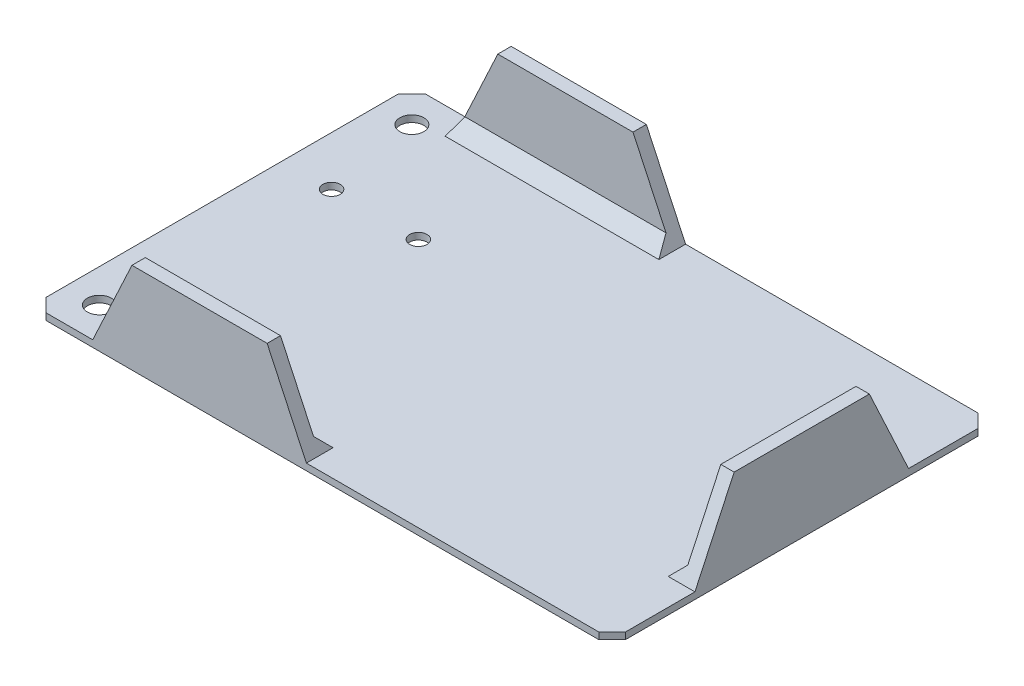
from build123d import *

# Parameters (mm, degrees)
SKETCH1_W           = 110.236
SKETCH1_H           = 72.136
BOSS_EXTRUDE1_DEPTH = 1.27
SKETCH2_R           = 2.286
SKETCH2_R_2         = 1.651
CUT_EXTRUDE1_DEPTH  = 1.27
SKETCH3_W           = 25.4
SKETCH3_H           = 2.54
SKETCH3_W_2         = 2.54
SKETCH3_H_2         = 25.4
BOSS_EXTRUDE2_DEPTH = 16
CHAMFER1_SIZE       = 7.62
CHAMFER1_SIZE_2     = 16.341142734
CHAMFER2_SIZE       = 2.54
CHAMFER3_SIZE       = 2.54


with BuildPart() as part:
    # Sketch1 → Boss-Extrude1 (new body)
    with BuildSketch(Plane(origin=(0, 0, 0), x_dir=(1, 0, 0), z_dir=(0, 1, 0))):
        with Locations((55.118, 36.068)):
            Rectangle(SKETCH1_W, SKETCH1_H)
    extrude(amount=BOSS_EXTRUDE1_DEPTH)

    # Sketch2 → Cut-Extrude1 (cut)
    with BuildSketch(Plane(origin=(0, 1.27, 0), x_dir=(1, 0, 0), z_dir=(0, 1, 0))):
        with Locations(Location((6.35, 65.786, 0), (0, 0, 270))):
            Circle(SKETCH2_R)
        with Locations(Location((9.363, 47.498, 0), (0, 0, 270))):
            Circle(SKETCH2_R_2)
        with Locations(Location((25.873, 47.498, 0), (0, 0, 270))):
            Circle(SKETCH2_R_2)
        with Locations(Location((6.35, 6.35, 0), (0, 0, 90))):
            Circle(SKETCH2_R)
    extrude(amount=-CUT_EXTRUDE1_DEPTH, mode=Mode.SUBTRACT)

    # Sketch3 → Boss-Extrude2 (add)
    with BuildSketch(Plane(origin=(0, 1.27, 0), x_dir=(1, 0, 0), z_dir=(0, 1, 0))):
        with Locations((31.75, 70.866)):
            Rectangle(SKETCH3_W, SKETCH3_H)
        with Locations((31.75, 1.27)):
            Rectangle(SKETCH3_W, SKETCH3_H)
        with Locations((108.966, 36.068)):
            Rectangle(SKETCH3_W_2, SKETCH3_H_2)
    extrude(amount=BOSS_EXTRUDE2_DEPTH)

    # Chamfer1
    # the kernel refuses this chamfer: 16.341142734, 7.62 mm, written as the material it adds along each edge
    with BuildSketch(Plane(origin=(44.45, 1.27, -2.54), x_dir=(0.9971975577536774, -0.07481330637060034, 0), z_dir=(0, 0, 1))) as chamfer1_piece_1_section:
        Polygon((CHAMFER1_SIZE * 0.997197557754, CHAMFER1_SIZE * 0.0748133063706), (-CHAMFER1_SIZE_2 * 0.0748133063719, CHAMFER1_SIZE_2 * 0.997197557771), (0, 0), align=None)
    chamfer1_piece_1 = extrude(amount=2.54, mode=Mode.PRIVATE)
    chamfer1_piece_1 = split(chamfer1_piece_1, bisect_by=Plane(origin=(46.87141812, 17.27, -1.27), z_dir=(0, -1, 0)), keep=Keep.TOP, mode=Mode.PRIVATE)
    add(chamfer1_piece_1)
    with BuildSketch(Plane(origin=(44.45, 1.27, -72.136), x_dir=(0.9971975577536774, -0.07481330637060034, 2.7895727589747506e-15), z_dir=(0, 0, 1))) as chamfer1_piece_2_section:
        Polygon((CHAMFER1_SIZE * 0.997197557754, CHAMFER1_SIZE * 0.0748133063706), (-CHAMFER1_SIZE_2 * 0.0748133063719, CHAMFER1_SIZE_2 * 0.997197557771), (0, 0), align=None)
    chamfer1_piece_2 = extrude(amount=2.54, mode=Mode.PRIVATE)
    chamfer1_piece_2 = split(chamfer1_piece_2, bisect_by=Plane(origin=(46.87141812, 17.27, -70.866), z_dir=(0, -1, 0)), keep=Keep.TOP, mode=Mode.PRIVATE)
    add(chamfer1_piece_2)
    with BuildSketch(Plane(origin=(19.05, 1.27, 0), x_dir=(-0.9971975577536774, -0.07481330637060028, 0), z_dir=(0, 0, -1))) as chamfer1_piece_3_section:
        Polygon((CHAMFER1_SIZE * 0.997197557754, CHAMFER1_SIZE * 0.0748133063706), (-CHAMFER1_SIZE_2 * 0.0748133063719, CHAMFER1_SIZE_2 * 0.997197557771), (0, 0), align=None)
    chamfer1_piece_3 = extrude(amount=2.54, mode=Mode.PRIVATE)
    chamfer1_piece_3 = split(chamfer1_piece_3, bisect_by=Plane(origin=(16.62858188, 17.27, -1.27), z_dir=(0, -1, 0)), keep=Keep.TOP, mode=Mode.PRIVATE)
    add(chamfer1_piece_3)
    with BuildSketch(Plane(origin=(19.05, 1.27, -69.596), x_dir=(-0.9971975577536774, -0.07481330637060032, 5.5791455179495004e-15), z_dir=(0, 0, -1))) as chamfer1_piece_4_section:
        Polygon((CHAMFER1_SIZE * 0.997197557754, CHAMFER1_SIZE * 0.0748133063706), (-CHAMFER1_SIZE_2 * 0.0748133063719, CHAMFER1_SIZE_2 * 0.997197557771), (0, 0), align=None)
    chamfer1_piece_4 = extrude(amount=2.54, mode=Mode.PRIVATE)
    chamfer1_piece_4 = split(chamfer1_piece_4, bisect_by=Plane(origin=(16.62858188, 17.27, -70.866), z_dir=(0, -1, 0)), keep=Keep.TOP, mode=Mode.PRIVATE)
    add(chamfer1_piece_4)
    with BuildSketch(Plane(origin=(107.696, 1.27, -48.768), x_dir=(0, -0.07481330637060034, -0.9971975577536774), z_dir=(1, 0, 0))) as chamfer1_piece_5_section:
        Polygon((CHAMFER1_SIZE * 0.997197557754, CHAMFER1_SIZE * 0.0748133063706), (-CHAMFER1_SIZE_2 * 0.0748133063719, CHAMFER1_SIZE_2 * 0.997197557771), (0, 0), align=None)
    chamfer1_piece_5 = extrude(amount=2.54, mode=Mode.PRIVATE)
    chamfer1_piece_5 = split(chamfer1_piece_5, bisect_by=Plane(origin=(108.966, 17.27, -51.18941812), z_dir=(0, -1, 0)), keep=Keep.TOP, mode=Mode.PRIVATE)
    add(chamfer1_piece_5)
    with BuildSketch(Plane(origin=(110.236, 1.27, -23.368), x_dir=(0, -0.07481330637060032, 0.9971975577536774), z_dir=(-1, 0, 0))) as chamfer1_piece_6_section:
        Polygon((CHAMFER1_SIZE * 0.997197557754, CHAMFER1_SIZE * 0.0748133063706), (-CHAMFER1_SIZE_2 * 0.0748133063719, CHAMFER1_SIZE_2 * 0.997197557771), (0, 0), align=None)
    chamfer1_piece_6 = extrude(amount=2.54, mode=Mode.PRIVATE)
    chamfer1_piece_6 = split(chamfer1_piece_6, bisect_by=Plane(origin=(108.966, 17.27, -20.94658188), z_dir=(0, -1, 0)), keep=Keep.TOP, mode=Mode.PRIVATE)
    add(chamfer1_piece_6)

    # Chamfer2
    chamfer2_edges = [part.edges().sort_by_distance(p)[0] for p in [
        (31.75, 1.27, -69.596),
        (31.75, 1.27, -2.54),
        (107.696, 1.27, -36.068),
    ]]
    chamfer(chamfer2_edges, length=CHAMFER2_SIZE)

    # Chamfer3
    chamfer3_edges = [part.edges().sort_by_distance(p)[0] for p in [
        (0, 0.635, -72.136),
        (110.236, 0.635, -72.136),
        (110.236, 0.635, 0),
        (0, 0.635, 0),
    ]]
    chamfer(chamfer3_edges, length=CHAMFER3_SIZE)


solid = part.part
